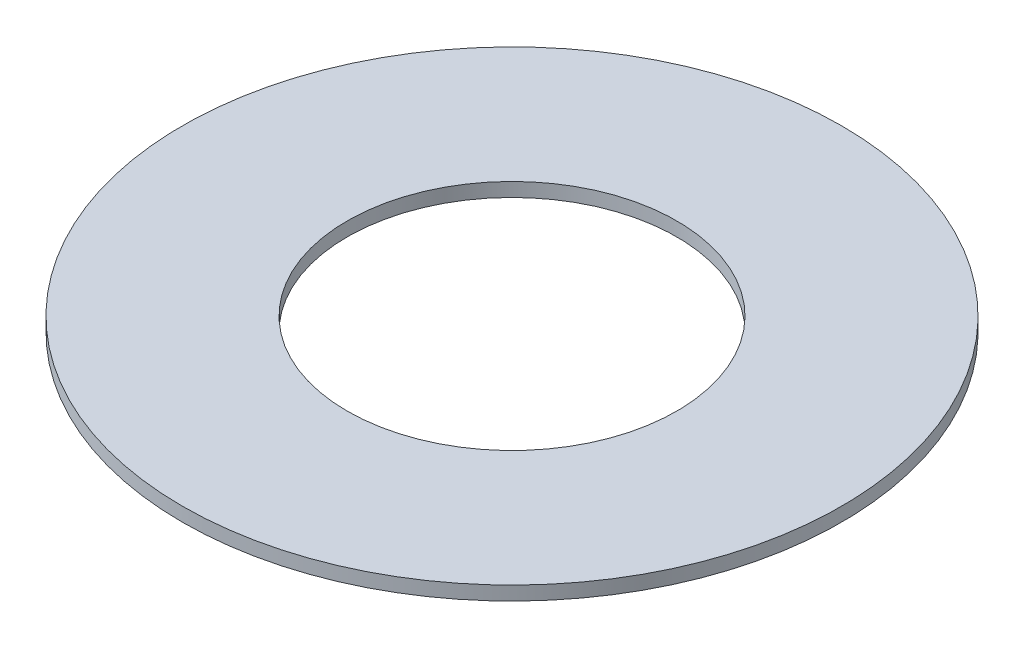
from build123d import *

# Parameters (mm, degrees)
SKETCH1_R           = 95
BOSS_EXTRUDE1_DEPTH = 4
SKETCH2_R           = 47.5
CUT_EXTRUDE1_DEPTH  = 135.40982107


with BuildPart() as part:
    # Sketch1 → Boss-Extrude1 (new body)
    with BuildSketch(Plane(origin=(0, 0, 0), x_dir=(1, 0, 0), z_dir=(0, 1, 0))):
        Circle(SKETCH1_R)
    extrude(amount=BOSS_EXTRUDE1_DEPTH)

    # Sketch2 → Cut-Extrude1 (cut, through all)
    with BuildSketch(Plane(origin=(0, 0, 0), x_dir=(1, 0, 0), z_dir=(0, 1, 0))):
        Circle(SKETCH2_R)
    extrude(amount=CUT_EXTRUDE1_DEPTH, mode=Mode.SUBTRACT)


solid = part.part
